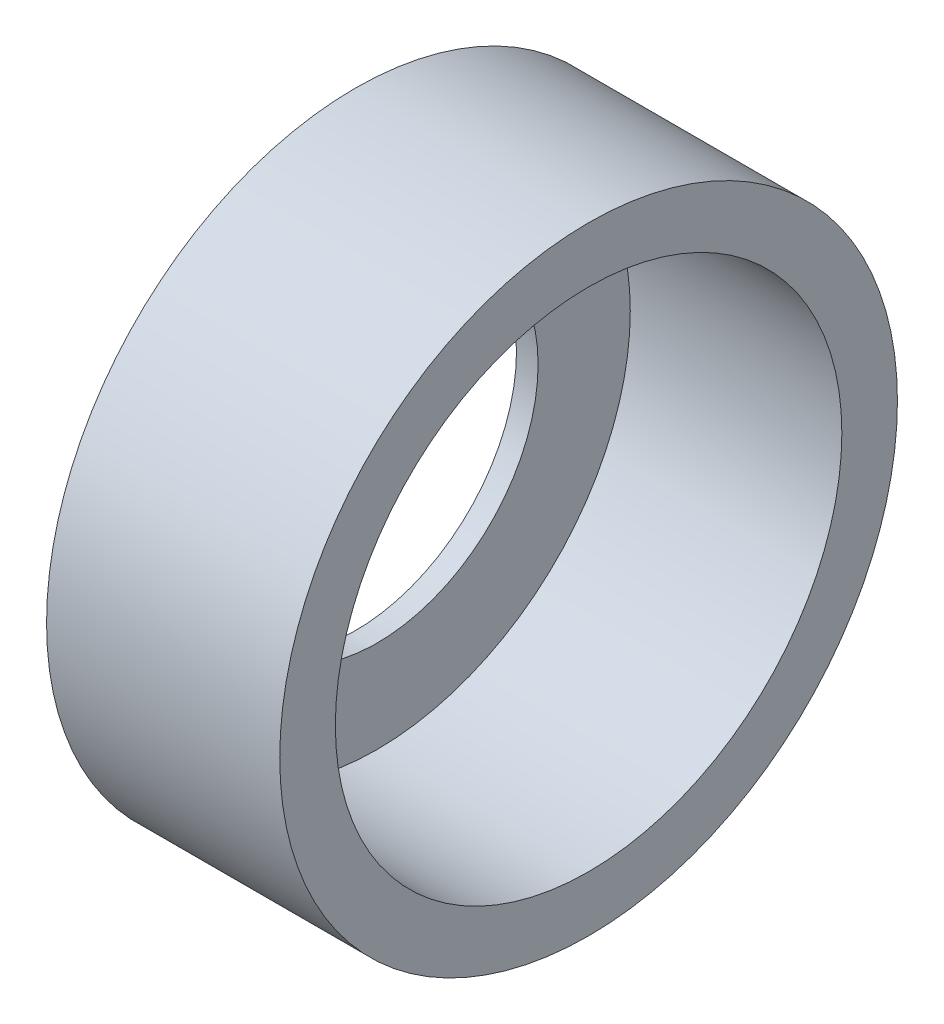
from build123d import *


with BuildPart() as part:
    # Skizze2 → Rotation1 (revolve)
    with BuildSketch(Plane.XY):
        Polygon((0, 26.075), (3.5, 26.075), (3.5, 41), (37.75, 41), (37.75, 50), (0, 50), align=None)
    revolve(axis=Axis((0, 0, 0), (-1, 0, 0)))


solid = part.part
